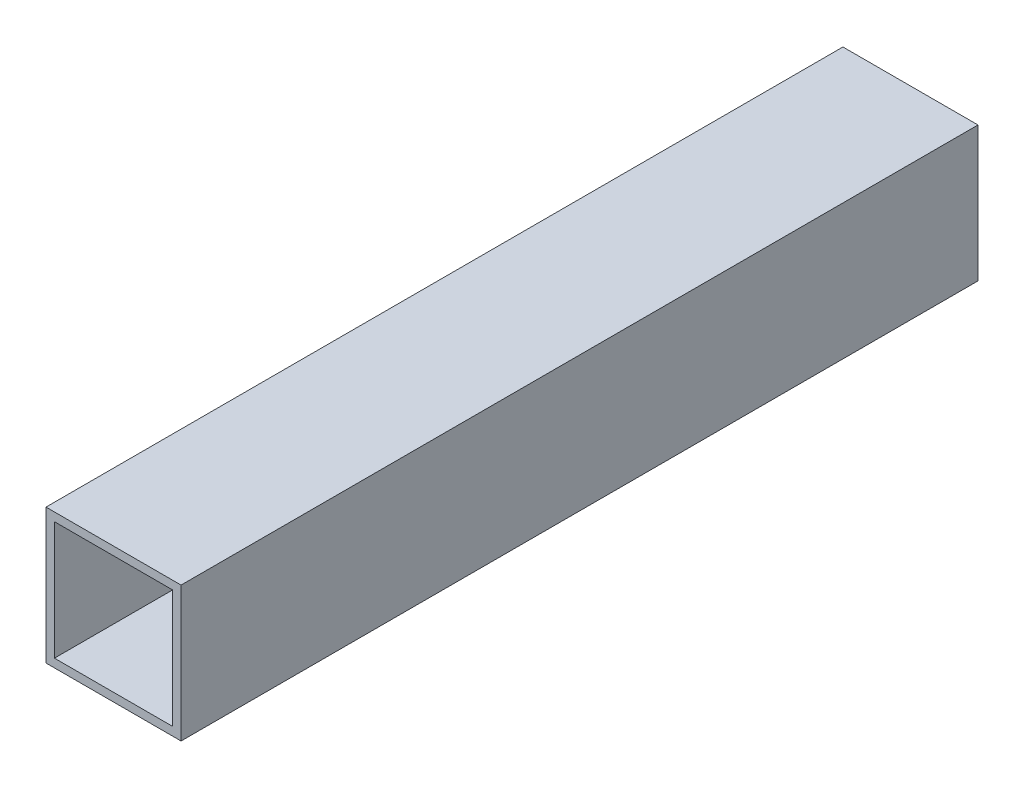
from build123d import *

# Parameters (mm, degrees)
SKETCH1_W           = 25.4
SKETCH1_H           = 25.4
BOSS_EXTRUDE1_DEPTH = 74.93
SHELL1_T            = -1.5875


with BuildPart() as part:
    # Sketch1 → Boss-Extrude1 (new, symmetric)
    with BuildSketch(Plane.XY):
        Rectangle(SKETCH1_W, SKETCH1_H)
    extrude(amount=BOSS_EXTRUDE1_DEPTH, both=True)

    # Shell1
    shell1_openings = [part.faces().sort_by_distance(p)[0] for p in [
        (0, 0, -74.93),
        (0, 0, 74.93),
    ]]
    offset(amount=SHELL1_T, openings=shell1_openings, kind=Kind.INTERSECTION)


solid = part.part
